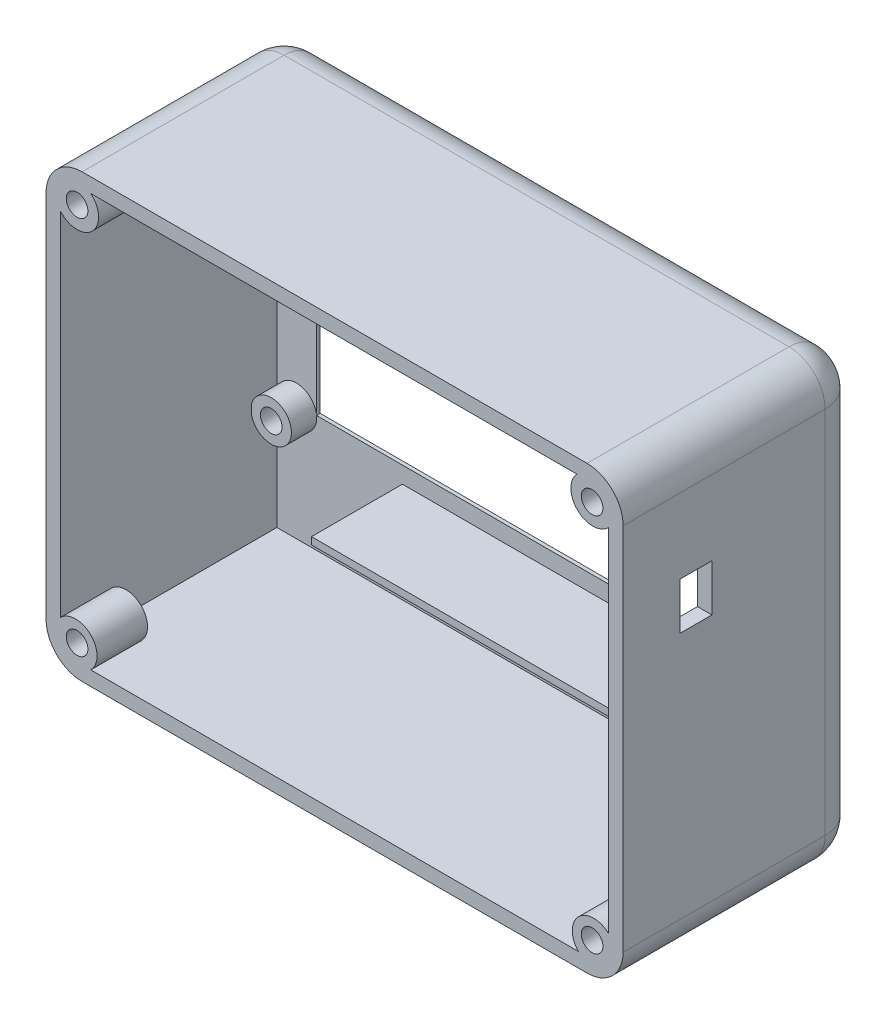
from build123d import *

# Parameters (mm, degrees)
ESQUISSE1_W             = 76.9
ESQUISSE1_H             = 57.2
ESQUISSE1_R             = 1.5
ESQUISSE1_W_2           = 62.63
ESQUISSE1_H_2           = 39
BOSS_EXTRU_1_DEPTH      = 3
ESQUISSE2_W             = 3.5
ESQUISSE2_H             = 43.3
BOSS_EXTRU_2_DEPTH      = 3
ESQUISSE3_W             = 80
ESQUISSE3_H             = 61.2
ESQUISSE3_W_2           = 76
ESQUISSE3_H_2           = 57.2
BOSS_EXTRU_3_DEPTH      = 33
ESQUISSE4_R             = 2.80134662
ESQUISSE4_R_2           = 1.516296111
ESQUISSE4_R_3           = 1.5
ESQUISSE4_R_4           = 2.602114883
BOSS_EXTRU_4_DEPTH      = 3.5
ESQUISSE5_R             = 1.5
BOSS_EXTRU_5_DEPTH      = 2
CONG_2_R                = 5
CONG_3_R                = 5
ESQUISSE6_W             = 4.441802337
ESQUISSE6_H             = 6.5
ENL_V_MAT_EXTRU_1_DEPTH = 10
ESQUISSE8_R             = 1.5
BOSS_EXTRU_7_DEPTH      = 7
CHANFREIN1_SIZE         = 2.5
CHANFREIN1_SIZE_2       = 2.11901059
ESQUISSE10_W            = 58.6
ESQUISSE10_H            = 1
BOSS_EXTRU_8_DEPTH      = 12.6


with BuildPart() as part:
    # Esquisse1 → Boss.-Extru.1 (new body)
    with BuildSketch(Plane.XY):
        with Locations((11.549287317, -7.392133332)):
            Rectangle(ESQUISSE1_W, ESQUISSE1_H)
        with Locations((-24.185949278, 18.907866668)):
            Circle(ESQUISSE1_R, mode=Mode.SUBTRACT)
        with Locations((43.814050722, 18.907866668)):
            Circle(ESQUISSE1_R, mode=Mode.SUBTRACT)
        with Locations((-24.185949278, -20.092133332)):
            Circle(ESQUISSE1_R, mode=Mode.SUBTRACT)
        with Locations((43.814050722, -20.092133332)):
            Circle(ESQUISSE1_R, mode=Mode.SUBTRACT)
        with Locations((9.914287317, -0.292133332)):
            Rectangle(ESQUISSE1_W_2, ESQUISSE1_H_2, mode=Mode.SUBTRACT)
    extrude(amount=BOSS_EXTRU_1_DEPTH)

    # Esquisse2 → Boss.-Extru.2 (add)
    with BuildSketch(Plane.XY):
        with Locations((47.349287317, -0.442133332)):
            Rectangle(ESQUISSE2_W, ESQUISSE2_H)
    extrude(amount=BOSS_EXTRU_2_DEPTH)

    # Esquisse3 → Boss.-Extru.3 (add)
    with BuildSketch(Plane.XY):
        with Locations((11.099287317, -7.392133332)):
            Rectangle(ESQUISSE3_W, ESQUISSE3_H)
        with Locations((11.099287317, -7.392133332)):
            Rectangle(ESQUISSE3_W_2, ESQUISSE3_H_2, mode=Mode.SUBTRACT)
    extrude(amount=BOSS_EXTRU_3_DEPTH)

    # Esquisse4 → Boss.-Extru.4 (add)
    # profile 1 of 4: a face of its own
    with BuildSketch(Plane.XY.offset(3)):
        with Locations((-24.185949278, 18.907866668)):
            Circle(ESQUISSE4_R)
        with Locations((-24.185949278, 18.907866668)):
            Circle(ESQUISSE4_R_2, mode=Mode.SUBTRACT)
    # profile 2 of 4: a face of its own
    with BuildSketch(Plane.XY.offset(3)):
        with Locations((-24.185949278, -20.092133332)):
            Circle(ESQUISSE4_R)
        with Locations((-24.185949278, -20.092133332)):
            Circle(ESQUISSE4_R_3, mode=Mode.SUBTRACT)
    # profile 3 of 4: a face of its own
    with BuildSketch(Plane.XY.offset(3)):
        with Locations(Location((43.814050722, -20.092133332, 0), (0, 0, 173.379599702))):
            Circle(ESQUISSE4_R_4)
        with Locations((43.814050722, -20.092133332)):
            Circle(ESQUISSE4_R_3, mode=Mode.SUBTRACT)
    # profile 4 of 4: a face of its own
    with BuildSketch(Plane.XY.offset(3)):
        with Locations((43.814050722, 18.907866668)):
            Circle(ESQUISSE4_R_4)
        with Locations((43.814050722, 18.907866668)):
            Circle(ESQUISSE4_R_3, mode=Mode.SUBTRACT)
    extrude(amount=BOSS_EXTRU_4_DEPTH)

    # Esquisse5 → Boss.-Extru.5 (add)
    with BuildSketch(Plane.XY):
        with Locations((-24.185949278, 18.907866668)):
            Circle(ESQUISSE5_R)
        with Locations((-24.185949278, -20.092133332)):
            Circle(ESQUISSE5_R)
        with Locations((43.814050722, 18.907866668)):
            Circle(ESQUISSE5_R)
        with Locations((43.814050722, -20.092133332)):
            Circle(ESQUISSE5_R)
    extrude(amount=BOSS_EXTRU_5_DEPTH)

    # Congé2
    # the kernel refuses this fillet: 5 mm, written as the material it takes off along each edge
    with BuildSketch(Plane(origin=(-28.900712683, -50.492133332, 0), x_dir=(1, 0, 0), z_dir=(0, 1, 0)), Plane(origin=(51.099287317, 35.707866668, 0), x_dir=(-1, 0, 0), z_dir=(0, -1, 0))) as cong_2_piece_1:
        with BuildLine():
            CenterArc((CONG_2_R, -CONG_2_R), CONG_2_R, 90, 90)
            Line((0, -CONG_2_R), (0, 0))
            Line((0, 0), (CONG_2_R, 0))
        make_face()
    extrude(amount=86.2, mode=Mode.SUBTRACT)
    with BuildSketch(Plane(origin=(63.599287317, -37.992133332, 0), x_dir=(0, 1, 0), z_dir=(-1, 0, 0)), Plane(origin=(-41.400712683, 23.207866668, 0), x_dir=(0, -1, 0), z_dir=(1, 0, 0))) as cong_2_piece_2:
        with BuildLine():
            CenterArc((CONG_2_R, -CONG_2_R), CONG_2_R, 90, 90)
            Line((0, -CONG_2_R), (0, 0))
            Line((0, 0), (CONG_2_R, 0))
        make_face()
    extrude(amount=105, mode=Mode.SUBTRACT)

    # Congé3
    # the kernel refuses this fillet: 5 mm, written as the material it takes off along each edge
    with BuildSketch(Plane(origin=(46.099287317, 18.207866668, 5), x_dir=(1, 0, 0), z_dir=(0, 1, 0))) as cong_3_piece_1_section:
        Polygon((0, 0), (CONG_3_R, 0), (CONG_3_R, CONG_3_R), (0, CONG_3_R), align=None)
    cong_3_piece_1 = extrude(amount=CONG_3_R, mode=Mode.PRIVATE)
    cong_3_piece_1 = cong_3_piece_1 - Plane(origin=(46.099287317, 18.207866668, 5), x_dir=(-0.7071067811865475, 0, 0.7071067811865475), z_dir=(0, 1, 0)) * Sphere(CONG_3_R, mode=Mode.PRIVATE)
    add(cong_3_piece_1, mode=Mode.SUBTRACT)
    with BuildSketch(Plane(origin=(46.099287317, -32.992133332, 5), x_dir=(0, -1, 0), z_dir=(1, 0, 0))) as cong_3_piece_2_section:
        Polygon((0, 0), (CONG_3_R, 0), (CONG_3_R, CONG_3_R), (0, CONG_3_R), align=None)
    cong_3_piece_2 = extrude(amount=CONG_3_R, mode=Mode.PRIVATE)
    cong_3_piece_2 = cong_3_piece_2 - Plane(origin=(46.099287317, -32.992133332, 5), x_dir=(0, 0.7071067811865475, 0.7071067811865475), z_dir=(1, 0, 0)) * Sphere(CONG_3_R, mode=Mode.PRIVATE)
    add(cong_3_piece_2, mode=Mode.SUBTRACT)
    with BuildSketch(Plane(origin=(-23.900712683, 18.207866668, 5), x_dir=(-1, 0, 0), z_dir=(0, 1, 0))) as cong_3_piece_3_section:
        Polygon((0, 0), (CONG_3_R, 0), (CONG_3_R, -CONG_3_R), (0, -CONG_3_R), align=None)
    cong_3_piece_3 = extrude(amount=CONG_3_R, mode=Mode.PRIVATE)
    cong_3_piece_3 = cong_3_piece_3 - Plane(origin=(-23.900712683, 18.207866668, 5), x_dir=(0.7071067811865475, 0, 0.7071067811865475), z_dir=(0, 1, 0)) * Sphere(CONG_3_R, mode=Mode.PRIVATE)
    add(cong_3_piece_3, mode=Mode.SUBTRACT)
    with BuildSketch(Plane(origin=(-23.900712683, -32.992133332, 5), x_dir=(-1, 0, 0), z_dir=(0, -1, 0))) as cong_3_piece_4_section:
        Polygon((0, 0), (CONG_3_R, 0), (CONG_3_R, CONG_3_R), (0, CONG_3_R), align=None)
    cong_3_piece_4 = extrude(amount=CONG_3_R, mode=Mode.PRIVATE)
    cong_3_piece_4 = cong_3_piece_4 - Plane(origin=(-23.900712683, -32.992133332, 5), x_dir=(0.7071067811865475, 0, 0.7071067811865475), z_dir=(0, -1, 0)) * Sphere(CONG_3_R, mode=Mode.PRIVATE)
    add(cong_3_piece_4, mode=Mode.SUBTRACT)
    with BuildSketch(Plane(origin=(-28.900712683, 23.207866668, 5), x_dir=(1, 0, 0), z_dir=(0, 0, 1))) as cong_3_piece_5:
        with BuildLine():
            CenterArc((CONG_3_R, -CONG_3_R), CONG_3_R, 90, 90)
            Line((0, -CONG_3_R), (0, 0))
            Line((0, 0), (CONG_3_R, 0))
        make_face()
    extrude(amount=40.5, mode=Mode.SUBTRACT)
    with BuildSketch(Plane(origin=(-28.900712683, -37.992133332, 5), x_dir=(1, 0, 0), z_dir=(0, 0, 1)), Plane(origin=(51.099287317, -37.992133332, 5), x_dir=(0, 1, 0), z_dir=(0, 0, 1)), Plane(origin=(51.099287317, 23.207866668, 5), x_dir=(-1, 0, 0), z_dir=(0, 0, 1))) as cong_3_piece_6:
        with BuildLine():
            CenterArc((CONG_3_R, CONG_3_R), CONG_3_R, 180, 90)
            Line((0, CONG_3_R), (0, 0))
            Line((0, 0), (CONG_3_R, 0))
        make_face()
    extrude(amount=40.5, mode=Mode.SUBTRACT)

    # Esquisse6 → Enlèv. mat.-Extru.1 (cut)
    with BuildSketch(Plane.ZY.offset(-49.099287317)):
        with Locations((22.920901169, 4.607866668)):
            Rectangle(ESQUISSE6_W, ESQUISSE6_H)
    extrude(amount=-ENL_V_MAT_EXTRU_1_DEPTH, mode=Mode.SUBTRACT)

    # Esquisse8 → Boss.-Extru.7 (add)
    # profile 1 of 4: a face of its own
    with BuildSketch(Plane.XY.offset(33)):
        with BuildLine():
            Line((-26.900712683, 21.207866668), (-26.900712683, 17.007866668))
            ThreePointArc((-26.900712683, 17.007866668), (-22.491210372, 16.798364357), (-22.700712683, 21.207866668))
            Line((-22.700712683, 21.207866668), (-26.900712683, 21.207866668))
        make_face()
        with Locations((-24.600712683, 18.907866668)):
            Circle(ESQUISSE8_R, mode=Mode.SUBTRACT)
    # profile 2 of 4: a face of its own
    with BuildSketch(Plane.XY.offset(33)):
        with BuildLine():
            Line((49.099287317, 17.007866668), (49.099287317, 21.207866668))
            Line((49.099287317, 21.207866668), (44.696667897, 21.207866668))
            ThreePointArc((44.696667897, 21.207866668), (44.797977607, 16.906556958), (49.099287317, 17.007866668))
        make_face()
        with Locations((46.799287317, 18.907866668)):
            Circle(ESQUISSE8_R, mode=Mode.SUBTRACT)
    # profile 3 of 4: a face of its own
    with BuildSketch(Plane.XY.offset(33)):
        with BuildLine():
            Line((-26.900712683, -35.992133332), (-22.700712683, -35.992133332))
            ThreePointArc((-22.700712683, -35.992133332), (-22.700712683, -31.792133332), (-26.900712683, -31.792133332))
            Line((-26.900712683, -31.792133332), (-26.900712683, -35.992133332))
        make_face()
        with Locations((-24.600712683, -33.692133332)):
            Circle(ESQUISSE8_R, mode=Mode.SUBTRACT)
    # profile 4 of 4: a face of its own
    with BuildSketch(Plane.XY.offset(33)):
        with BuildLine():
            Line((49.099287317, -35.992133332), (49.099287317, -31.792133332))
            ThreePointArc((49.099287317, -31.792133332), (44.92039338, -31.813239396), (44.899287317, -35.992133332))
            Line((44.899287317, -35.992133332), (49.099287317, -35.992133332))
        make_face()
        with Locations((46.799287317, -33.692133332)):
            Circle(ESQUISSE8_R, mode=Mode.SUBTRACT)
    extrude(amount=-BOSS_EXTRU_7_DEPTH)

    # Chanfrein1
    # the kernel refuses this chamfer: 2.5, 2.11901059 mm, written as the material it takes off along each edge
    with BuildSketch(Plane(origin=(-21.400712683, -19.792133332, 0), x_dir=(-1, 0, 0), z_dir=(0, 1, 0)), Plane(origin=(41.229287317, 18.207866668, 0), x_dir=(1, 0, 0), z_dir=(0, -1, 0))) as chanfrein1_piece_1:
        Polygon((CHANFREIN1_SIZE, 0), (0, CHANFREIN1_SIZE), (0, 0), align=None)
    extrude(amount=38, mode=Mode.SUBTRACT)
    with BuildSketch(Plane(origin=(-21.400712683, 18.207866668, 5), x_dir=(0, 0.9965085211042171, -0.08349112148418099), z_dir=(0, 0.08349112148418099, 0.9965085211042171))) as chanfrein1_piece_2_section:
        Polygon((5, CHANFREIN1_SIZE), (5 - CHANFREIN1_SIZE, 0), (5, 0), align=None)
    chanfrein1_piece_2 = revolve(axis=Axis((-21.400712683, 18.207866668, 5), (-1, 0, 0)), revolution_arc=85.210735942, mode=Mode.PRIVATE)
    chanfrein1_piece_2 = split(chanfrein1_piece_2, bisect_by=Plane(origin=(-21.400712683, 19.207866668, 5), z_dir=(0, -1, 0)), keep=Keep.TOP, mode=Mode.PRIVATE)
    add(chanfrein1_piece_2, mode=Mode.SUBTRACT)
    with BuildSketch(Plane(origin=(41.229287317, 18.207866668, 5), x_dir=(0, 0.9965085211042173, -0.08349112148417923), z_dir=(0, 0.08349112148417923, 0.9965085211042173))) as chanfrein1_piece_3_section:
        Polygon((5, -CHANFREIN1_SIZE), (5 - CHANFREIN1_SIZE, 0), (5, 0), align=None)
    chanfrein1_piece_3 = revolve(axis=Axis((41.229287317, 18.207866668, 5), (-1, 0, 0)), revolution_arc=85.210735942, mode=Mode.PRIVATE)
    chanfrein1_piece_3 = split(chanfrein1_piece_3, bisect_by=Plane(origin=(41.229287317, 19.207866668, 5), z_dir=(0, -1, 0)), keep=Keep.TOP, mode=Mode.PRIVATE)
    add(chanfrein1_piece_3, mode=Mode.SUBTRACT)
    with BuildSketch(Plane(origin=(41.229287317, -19.792133332, 0), x_dir=(0, -1, 0), z_dir=(-1, 0, 0))) as chanfrein1_piece_4:
        Polygon((CHANFREIN1_SIZE, 0), (0, CHANFREIN1_SIZE), (0, 0), align=None)
    extrude(amount=62.63, mode=Mode.SUBTRACT)
    with BuildSketch(Plane(origin=(41.229287317, 19.207866668, 0.101020514), x_dir=(0, 0.9157709220432261, 0.40170090657116964), z_dir=(-1, 0, 0))) as chanfrein1_piece_5:
        with BuildLine():
            Line((2.104307157, 0), (CHANFREIN1_SIZE_2 * 0.401700906568, -CHANFREIN1_SIZE_2 * 0.915770922035))
            Line((CHANFREIN1_SIZE_2 * 0.401700906568, -CHANFREIN1_SIZE_2 * 0.915770922035), (0, 0))
            ThreePointArc((0, 0), (1.079661864, 0.111880462), (2.104307157, 0))
        make_face()
    extrude(amount=62.63, mode=Mode.SUBTRACT)
    with BuildSketch(Plane(origin=(-21.400712683, -26.221340802, 0), x_dir=(-1, 0, 0), z_dir=(0, 1, 0))) as chanfrein1_piece_6a_section:
        Polygon((CHANFREIN1_SIZE, 0), (0, CHANFREIN1_SIZE), (0, 0), align=None)
    chanfrein1_piece_6a = extrude(amount=44.42920747, mode=Mode.PRIVATE)
    chanfrein1_piece_6a = split(chanfrein1_piece_6a, bisect_by=Plane(origin=(-21.400712683, -19.792133332, 0), z_dir=(0, -1, 0)), keep=Keep.TOP, mode=Mode.PRIVATE)
    with BuildSketch(Plane(origin=(41.229287317, -19.792133332, 0), x_dir=(0, -1, 0), z_dir=(-1, 0, 0))) as chanfrein1_piece_6b_section:
        Polygon((CHANFREIN1_SIZE, 0), (0, CHANFREIN1_SIZE), (0, 0), align=None)
    chanfrein1_piece_6b = extrude(amount=69.05920747, mode=Mode.PRIVATE)
    chanfrein1_piece_6b = split(chanfrein1_piece_6b, bisect_by=Plane(origin=(-21.400712683, -19.792133332, 0), z_dir=(-1, 0, 0)), keep=Keep.TOP, mode=Mode.PRIVATE)
    chanfrein1_piece_6 = chanfrein1_piece_6a & chanfrein1_piece_6b
    add(chanfrein1_piece_6, mode=Mode.SUBTRACT)
    with BuildSketch(Plane(origin=(41.229287317, 19.207866668, 0.101020514), x_dir=(0, 0.9157709220432261, 0.40170090657116964), z_dir=(-1, 0, 0))) as chanfrein1_piece_7a_section:
        with BuildLine():
            Line((2.104307157, 0), (CHANFREIN1_SIZE_2 * 0.401700906568, -CHANFREIN1_SIZE_2 * 0.915770922035))
            Line((CHANFREIN1_SIZE_2 * 0.401700906568, -CHANFREIN1_SIZE_2 * 0.915770922035), (0, 0))
            ThreePointArc((0, 0), (1.079661864, 0.111880462), (2.104307157, 0))
        make_face()
    chanfrein1_piece_7a = extrude(amount=68.069376073, mode=Mode.PRIVATE)
    chanfrein1_piece_7a = split(chanfrein1_piece_7a, bisect_by=Plane(origin=(-21.400712683, 19.207866668, 0.101020514), z_dir=(-1, 0, 0)), keep=Keep.TOP, mode=Mode.PRIVATE)
    with BuildSketch(Plane(origin=(-21.400712683, 18.207866668, 5), x_dir=(0, 0.9965085211042171, -0.08349112148418099), z_dir=(0, 0.08349112148418099, 0.9965085211042171))) as chanfrein1_piece_7b_section:
        Polygon((5, CHANFREIN1_SIZE), (5 - CHANFREIN1_SIZE, 0), (5, 0), align=None)
    chanfrein1_piece_7b = revolve(axis=Axis((-21.400712683, 18.207866668, 5), (-1, 0, 0)), revolution_arc=85.210735942, mode=Mode.PRIVATE)
    chanfrein1_piece_7b = split(chanfrein1_piece_7b, bisect_by=Plane(origin=(-21.400712683, 19.207866668, 5), z_dir=(0, 1, 0)), keep=Keep.TOP, mode=Mode.PRIVATE)
    chanfrein1_piece_7 = chanfrein1_piece_7a & chanfrein1_piece_7b
    add(chanfrein1_piece_7, mode=Mode.SUBTRACT)
    with BuildSketch(Plane(origin=(41.229287317, 18.207866668, 5), x_dir=(0, 0.9965085211042173, -0.08349112148417923), z_dir=(0, 0.08349112148417923, 0.9965085211042173))) as chanfrein1_piece_8a_section:
        Polygon((5, -CHANFREIN1_SIZE), (5 - CHANFREIN1_SIZE, 0), (5, 0), align=None)
    chanfrein1_piece_8a = revolve(axis=Axis((41.229287317, 18.207866668, 5), (-1, 0, 0)), revolution_arc=85.210735942, mode=Mode.PRIVATE)
    chanfrein1_piece_8a = split(chanfrein1_piece_8a, bisect_by=Plane(origin=(41.229287317, 19.207866668, 5), z_dir=(0, 1, 0)), keep=Keep.TOP, mode=Mode.PRIVATE)
    with BuildSketch(Plane(origin=(46.66866339, 19.207866668, 0.101020514), x_dir=(0, 0.9157709220432261, 0.40170090657116964), z_dir=(-1, 0, 0))) as chanfrein1_piece_8b_section:
        with BuildLine():
            Line((2.104307157, 0), (CHANFREIN1_SIZE_2 * 0.401700906568, -CHANFREIN1_SIZE_2 * 0.915770922035))
            Line((CHANFREIN1_SIZE_2 * 0.401700906568, -CHANFREIN1_SIZE_2 * 0.915770922035), (0, 0))
            ThreePointArc((0, 0), (1.079661864, 0.111880462), (2.104307157, 0))
        make_face()
    chanfrein1_piece_8b = extrude(amount=68.069376073, mode=Mode.PRIVATE)
    chanfrein1_piece_8b = split(chanfrein1_piece_8b, bisect_by=Plane(origin=(41.229287317, 19.207866668, 0.101020514), z_dir=(1, 0, 0)), keep=Keep.TOP, mode=Mode.PRIVATE)
    chanfrein1_piece_8 = chanfrein1_piece_8a & chanfrein1_piece_8b
    add(chanfrein1_piece_8, mode=Mode.SUBTRACT)
    with BuildSketch(Plane(origin=(47.658494787, -19.792133332, 0), x_dir=(0, -1, 0), z_dir=(-1, 0, 0))) as chanfrein1_piece_9a_section:
        Polygon((CHANFREIN1_SIZE, 0), (0, CHANFREIN1_SIZE), (0, 0), align=None)
    chanfrein1_piece_9a = extrude(amount=69.05920747, mode=Mode.PRIVATE)
    chanfrein1_piece_9a = split(chanfrein1_piece_9a, bisect_by=Plane(origin=(41.229287317, -19.792133332, 0), z_dir=(1, 0, 0)), keep=Keep.TOP, mode=Mode.PRIVATE)
    with BuildSketch(Plane(origin=(41.229287317, 18.207866668, 0), x_dir=(1, 0, 0), z_dir=(0, -1, 0))) as chanfrein1_piece_9b_section:
        Polygon((CHANFREIN1_SIZE, 0), (0, CHANFREIN1_SIZE), (0, 0), align=None)
    chanfrein1_piece_9b = extrude(amount=44.42920747, mode=Mode.PRIVATE)
    chanfrein1_piece_9b = split(chanfrein1_piece_9b, bisect_by=Plane(origin=(41.229287317, -19.792133332, 0), z_dir=(0, -1, 0)), keep=Keep.TOP, mode=Mode.PRIVATE)
    chanfrein1_piece_9 = chanfrein1_piece_9a & chanfrein1_piece_9b
    add(chanfrein1_piece_9, mode=Mode.SUBTRACT)

    # Esquisse10 → Boss.-Extru.8 (add)
    with BuildSketch(Plane.XY.offset(3)):
        with Locations((19.799287317, -22.592133332)):
            Rectangle(ESQUISSE10_W, ESQUISSE10_H)
    extrude(amount=BOSS_EXTRU_8_DEPTH)


solid = part.part
